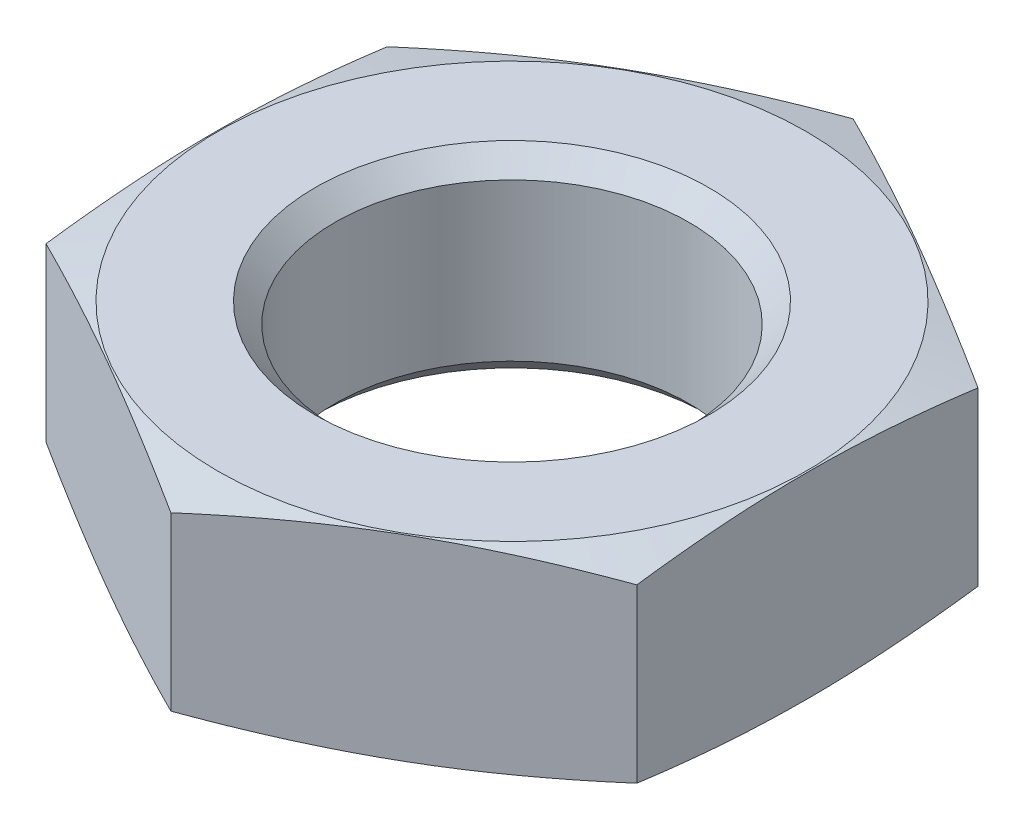
from build123d import *

# Parameters (mm, degrees)
SCHNITT_LINEAR_AUSTRAGEN1_DEPTH      = 9
SCHNITT_LINEAR_AUSTRAGEN1_DEPTH_BACK = 9
SKIZZE2_W                            = 96
SKIZZE2_H                            = 96


with BuildPart() as part:
    # Skizze1 → Rotation1 (revolve)
    with BuildSketch(Plane.XY):
        Polygon((0, 0), (11.95, 0), (26.87820323, -4), (11.95, -8), (0, -8), align=None)
    revolve(axis=Axis((0, -8, 0), (0, 1, 0)))

    # Skizze2 → Schnitt-Linear austragen1 (cut, two sides: drawn at the far end of the back side and taken through both)
    with BuildSketch(Plane(origin=(0, 0, 0), x_dir=(1, 0, 0), z_dir=(0, 1, 0)).offset(-SCHNITT_LINEAR_AUSTRAGEN1_DEPTH_BACK)):
        Rectangle(SKIZZE2_W, SKIZZE2_H)
        Polygon((-12, -6.92820323), (0, -13.856406461), (12, -6.92820323), (12, 6.92820323), (0, 13.856406461), (-12, 6.92820323), align=None, mode=Mode.SUBTRACT)
    extrude(amount=SCHNITT_LINEAR_AUSTRAGEN1_DEPTH + SCHNITT_LINEAR_AUSTRAGEN1_DEPTH_BACK, mode=Mode.SUBTRACT)

    # Skizze3 → Schnitt-Rotation1 (revolve, cut)
    with BuildSketch(Plane.XY):
        Polygon((0, 0), (8, 0), (7.188, -0.812), (7.188, -7.188), (8, -8), (0, -8), align=None)
    revolve(axis=Axis((0, -8, 0), (0, 1, 0)), mode=Mode.SUBTRACT)


solid = part.part
